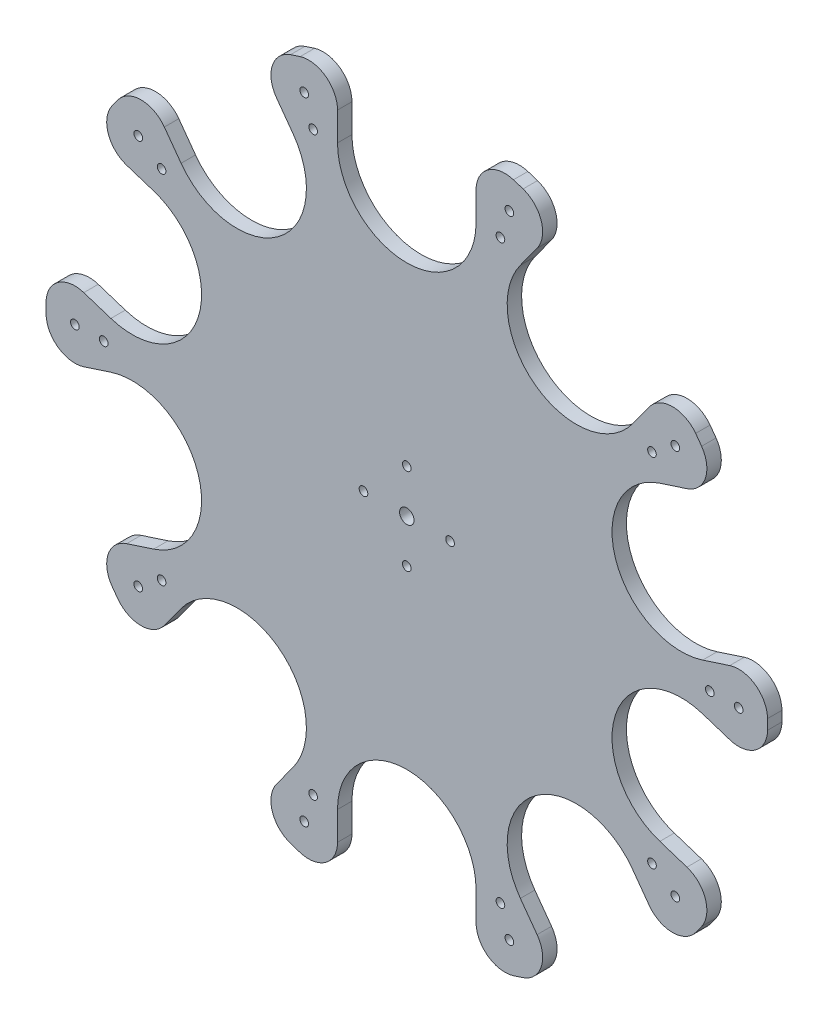
from build123d import *

# Parameters (mm, degrees)
EXTRUDE_1_DEPTH = 5


with BuildPart() as part:
    # 草图1 → 凸台-拉伸1 (new body)
    with BuildSketch(Plane.XY):
        with BuildLine():
            Line((-45.157092485, 102.984644478), (-39.362117364, 95.008545493))
            ThreePointArc((-39.362117364, 95.008545493), (-44.671679174, 61.485291572), (-78.194933094, 66.794853382))
            Line((-78.194933094, 66.794853382), (-83.989908215, 74.770952368))
            ThreePointArc((-83.989908215, 74.770952368), (-87.540173161, 77.803165087), (-92.080078159, 78.893099845))
            ThreePointArc((-92.080078159, 78.893099845), (-96.557407533, 77.83477316), (-100.087041477, 74.88380418))
            ThreePointArc((-100.087041477, 74.88380418), (-101.127124297, 73.473156537), (-102.147326663, 72.048064898))
            ThreePointArc((-102.147326663, 72.048064898), (-103.464208329, 63.127451833), (-97.065710474, 56.773654543))
            Line((-97.065710474, 56.773654543), (-87.689243765, 53.727055829))
            ThreePointArc((-87.689243765, 53.727055829), (-72.280295238, 23.485291572), (-102.522059495, 8.076343046))
            Line((-102.522059495, 8.076343046), (-111.898526204, 11.122941761))
            ThreePointArc((-111.898526204, 11.122941761), (-113.424351497, 11.489260004), (-114.988696148, 11.612376598))
            ThreePointArc((-114.988696148, 11.612376598), (-122.010018437, 8.732842405), (-124.987713204, 1.752583259))
            ThreePointArc((-124.987713204, 1.752583259), (-125, 0), (-124.987713204, -1.752583259))
            ThreePointArc((-124.987713204, -1.752583259), (-120.809688049, -9.743554451), (-111.898526204, -11.122941761))
            Line((-111.898526204, -11.122941761), (-102.522059495, -8.076343046))
            ThreePointArc((-102.522059495, -8.076343046), (-98.86007879, -7.197179263), (-95.10565163, -6.901699437))
            ThreePointArc((-95.10565163, -6.901699437), (-71.401131455, -27.147272277), (-87.689243765, -53.727055829))
            Line((-87.689243765, -53.727055829), (-97.065710474, -56.773654543))
            ThreePointArc((-97.065710474, -56.773654543), (-103.464208329, -63.127451833), (-102.147326663, -72.048064898))
            ThreePointArc((-102.147326663, -72.048064898), (-101.127124297, -73.473156537), (-100.087041477, -74.88380418))
            ThreePointArc((-100.087041477, -74.88380418), (-92.009973106, -78.892854106), (-83.989908215, -74.770952368))
            Line((-83.989908215, -74.770952368), (-78.194933094, -66.794853382))
            ThreePointArc((-78.194933094, -66.794853382), (-69.674297223, -59.517542857), (-58.778525229, -56.901699437))
            ThreePointArc((-58.778525229, -56.901699437), (-37.394368649, -70.005927444), (-39.362117364, -95.008545493))
            Line((-39.362117364, -95.008545493), (-45.157092485, -102.984644478))
            ThreePointArc((-45.157092485, -102.984644478), (-46.598917645, -111.88591714), (-40.290133197, -118.328801088))
            ThreePointArc((-40.290133197, -118.328801088), (-38.627124297, -118.882064537), (-36.956521739, -119.41195711))
            ThreePointArc((-36.956521739, -119.41195711), (-28.065575739, -117.907764962), (-24, -109.859000542))
            Line((-24, -109.859000542), (-24, -100))
            ThreePointArc((-24, -100), (-16.970562748, -83.029437252), (0, -76))
            ThreePointArc((0, -76), (16.970562748, -83.029437252), (24, -100))
            Line((24, -100), (24, -109.859000542))
            ThreePointArc((24, -109.859000542), (28.065575739, -117.907764962), (36.956521739, -119.41195711))
            ThreePointArc((36.956521739, -119.41195711), (38.627124297, -118.882064537), (40.290133197, -118.328801088))
            ThreePointArc((40.290133197, -118.328801088), (46.598917645, -111.88591714), (45.157092485, -102.984644478))
            Line((45.157092485, -102.984644478), (39.362117364, -95.008545493))
            ThreePointArc((39.362117364, -95.008545493), (37.394368649, -70.005927444), (58.778525229, -56.901699437))
            ThreePointArc((58.778525229, -56.901699437), (69.674297223, -59.517542857), (78.194933094, -66.794853382))
            Line((78.194933094, -66.794853382), (83.989908215, -74.770952368))
            ThreePointArc((83.989908215, -74.770952368), (92.009973106, -78.892854106), (100.087041477, -74.88380418))
            ThreePointArc((100.087041477, -74.88380418), (101.127124297, -73.473156537), (102.147326663, -72.048064898))
            ThreePointArc((102.147326663, -72.048064898), (103.464208329, -63.127451833), (97.065710474, -56.773654543))
            Line((97.065710474, -56.773654543), (87.689243765, -53.727055829))
            ThreePointArc((87.689243765, -53.727055829), (71.401131455, -27.147272277), (95.10565163, -6.901699437))
            ThreePointArc((95.10565163, -6.901699437), (98.86007879, -7.197179263), (102.522059495, -8.076343046))
            Line((102.522059495, -8.076343046), (111.898526204, -11.122941761))
            ThreePointArc((111.898526204, -11.122941761), (120.809688049, -9.743554451), (124.987713204, -1.752583259))
            ThreePointArc((124.987713204, -1.752583259), (125, 0), (124.987713204, 1.752583259))
            ThreePointArc((124.987713204, 1.752583259), (122.010018437, 8.732842405), (114.988696148, 11.612376598))
            ThreePointArc((114.988696148, 11.612376598), (113.424351497, 11.489260004), (111.898526204, 11.122941761))
            Line((111.898526204, 11.122941761), (102.522059495, 8.076343046))
            ThreePointArc((102.522059495, 8.076343046), (72.280295238, 23.485291572), (87.689243765, 53.727055829))
            Line((87.689243765, 53.727055829), (97.065710474, 56.773654543))
            ThreePointArc((97.065710474, 56.773654543), (103.464208329, 63.127451833), (102.147326663, 72.048064898))
            ThreePointArc((102.147326663, 72.048064898), (101.127124297, 73.473156537), (100.087041477, 74.88380418))
            ThreePointArc((100.087041477, 74.88380418), (96.557407533, 77.83477316), (92.080078159, 78.893099845))
            ThreePointArc((92.080078159, 78.893099845), (87.540173161, 77.803165087), (83.989908215, 74.770952368))
            Line((83.989908215, 74.770952368), (78.194933094, 66.794853382))
            ThreePointArc((78.194933094, 66.794853382), (44.671679174, 61.485291572), (39.362117364, 95.008545493))
            Line((39.362117364, 95.008545493), (45.157092485, 102.984644478))
            ThreePointArc((45.157092485, 102.984644478), (46.598917645, 111.88591714), (40.290133197, 118.328801088))
            ThreePointArc((40.290133197, 118.328801088), (38.627124297, 118.882064537), (36.956521739, 119.41195711))
            ThreePointArc((36.956521739, 119.41195711), (35.495064265, 119.746608081), (34, 119.859000542))
            ThreePointArc((34, 119.859000542), (26.928932188, 116.930068353), (24, 109.859000542))
            Line((24, 109.859000542), (24, 100))
            ThreePointArc((24, 100), (0, 76), (-24, 100))
            Line((-24, 100), (-24, 109.859000542))
            ThreePointArc((-24, 109.859000542), (-26.928932188, 116.930068353), (-34, 119.859000542))
            ThreePointArc((-34, 119.859000542), (-35.495064265, 119.746608081), (-36.956521739, 119.41195711))
            ThreePointArc((-36.956521739, 119.41195711), (-38.627124297, 118.882064537), (-40.290133197, 118.328801088))
            ThreePointArc((-40.290133197, 118.328801088), (-46.598917645, 111.88591714), (-45.157092485, 102.984644478))
        make_face()
        with BuildLine():
            ThreePointArc((-105, 1.5), (-106.5, 0), (-105, -1.5))
            ThreePointArc((-105, -1.5), (-103.5, 0), (-105, 1.5))
        make_face(mode=Mode.SUBTRACT)
        with BuildLine():
            ThreePointArc((-115, 1.5), (-116.5, 0), (-115, -1.5))
            ThreePointArc((-115, -1.5), (-113.5, 0), (-115, 1.5))
        make_face(mode=Mode.SUBTRACT)
        with BuildLine():
            ThreePointArc((0, 2.5), (-2.5, 0), (0, -2.5))
            ThreePointArc((0, -2.5), (2.5, 0), (0, 2.5))
        make_face(mode=Mode.SUBTRACT)
        with BuildLine():
            ThreePointArc((-84.065106531, 62.930976982), (-86.160309901, 62.599129369), (-85.828462288, 60.503925999))
            ThreePointArc((-85.828462288, 60.503925999), (-83.733258918, 60.835773612), (-84.065106531, 62.930976982))
        make_face(mode=Mode.SUBTRACT)
        with BuildLine():
            ThreePointArc((-92.155276475, 68.808829505), (-94.250479845, 68.476981892), (-93.918632232, 66.381778522))
            ThreePointArc((-93.918632232, 66.381778522), (-91.823428862, 66.713626135), (-92.155276475, 68.808829505))
        make_face(mode=Mode.SUBTRACT)
        with BuildLine():
            ThreePointArc((-31.020199635, 100.324459703), (-32.910309901, 101.287518985), (-33.873369184, 99.397408719))
            ThreePointArc((-33.873369184, 99.397408719), (-31.983258918, 98.434349437), (-31.020199635, 100.324459703))
        make_face(mode=Mode.SUBTRACT)
        with BuildLine():
            ThreePointArc((-34.110369579, 109.835024866), (-36.000479845, 110.798084148), (-36.963539128, 108.907973882))
            ThreePointArc((-36.963539128, 108.907973882), (-35.073428862, 107.9449146), (-34.110369579, 109.835024866))
        make_face(mode=Mode.SUBTRACT)
        with BuildLine():
            ThreePointArc((33.873369184, 99.397408719), (32.910309901, 101.287518985), (31.020199635, 100.324459703))
            ThreePointArc((31.020199635, 100.324459703), (31.983258918, 98.434349437), (33.873369184, 99.397408719))
        make_face(mode=Mode.SUBTRACT)
        with BuildLine():
            ThreePointArc((36.963539128, 108.907973882), (36.000479845, 110.798084148), (34.110369579, 109.835024866))
            ThreePointArc((34.110369579, 109.835024866), (35.073428862, 107.944914599), (36.963539128, 108.907973882))
        make_face(mode=Mode.SUBTRACT)
        with BuildLine():
            ThreePointArc((85.828462288, 60.503925999), (86.160309901, 62.599129369), (84.065106531, 62.930976982))
            ThreePointArc((84.065106531, 62.930976982), (83.733258918, 60.835773612), (85.828462288, 60.503925999))
        make_face(mode=Mode.SUBTRACT)
        with BuildLine():
            ThreePointArc((93.918632232, 66.381778522), (94.250479845, 68.476981892), (92.155276475, 68.808829505))
            ThreePointArc((92.155276475, 68.808829505), (91.823428862, 66.713626135), (93.918632232, 66.381778522))
        make_face(mode=Mode.SUBTRACT)
        with BuildLine():
            ThreePointArc((105, -1.5), (106.5, 0), (105, 1.5))
            ThreePointArc((105, 1.5), (103.5, 0), (105, -1.5))
        make_face(mode=Mode.SUBTRACT)
        with BuildLine():
            ThreePointArc((115, -1.5), (116.5, 0), (115, 1.5))
            ThreePointArc((115, 1.5), (113.5, 0), (115, -1.5))
        make_face(mode=Mode.SUBTRACT)
        with BuildLine():
            ThreePointArc((84.065106531, -62.930976982), (86.160309901, -62.599129369), (85.828462288, -60.503925999))
            ThreePointArc((85.828462288, -60.503925999), (83.733258918, -60.835773612), (84.065106531, -62.930976982))
        make_face(mode=Mode.SUBTRACT)
        with BuildLine():
            ThreePointArc((92.155276475, -68.808829505), (94.250479845, -68.476981892), (93.918632232, -66.381778522))
            ThreePointArc((93.918632232, -66.381778522), (91.823428862, -66.713626135), (92.155276475, -68.808829505))
        make_face(mode=Mode.SUBTRACT)
        with BuildLine():
            ThreePointArc((31.020199635, -100.324459703), (32.910309901, -101.287518985), (33.873369184, -99.397408719))
            ThreePointArc((33.873369184, -99.397408719), (31.983258918, -98.434349437), (31.020199635, -100.324459703))
        make_face(mode=Mode.SUBTRACT)
        with BuildLine():
            ThreePointArc((34.110369579, -109.835024866), (36.000479845, -110.798084148), (36.963539128, -108.907973882))
            ThreePointArc((36.963539128, -108.907973882), (35.073428862, -107.9449146), (34.110369579, -109.835024866))
        make_face(mode=Mode.SUBTRACT)
        with BuildLine():
            ThreePointArc((-33.873369184, -99.397408719), (-32.910309901, -101.287518985), (-31.020199635, -100.324459703))
            ThreePointArc((-31.020199635, -100.324459703), (-31.983258918, -98.434349437), (-33.873369184, -99.397408719))
        make_face(mode=Mode.SUBTRACT)
        with BuildLine():
            ThreePointArc((-36.963539128, -108.907973882), (-36.000479845, -110.798084148), (-34.110369579, -109.835024866))
            ThreePointArc((-34.110369579, -109.835024866), (-35.073428862, -107.944914599), (-36.963539128, -108.907973882))
        make_face(mode=Mode.SUBTRACT)
        with BuildLine():
            ThreePointArc((-85.828462288, -60.503925999), (-86.160309901, -62.599129369), (-84.065106531, -62.930976982))
            ThreePointArc((-84.065106531, -62.930976982), (-83.733258918, -60.835773612), (-85.828462288, -60.503925999))
        make_face(mode=Mode.SUBTRACT)
        with BuildLine():
            ThreePointArc((-93.918632232, -66.381778522), (-94.250479845, -68.476981892), (-92.155276475, -68.808829505))
            ThreePointArc((-92.155276475, -68.808829505), (-91.823428862, -66.713626135), (-93.918632232, -66.381778522))
        make_face(mode=Mode.SUBTRACT)
        with BuildLine():
            ThreePointArc((15, 1.5), (13.5, 0), (15, -1.5))
            ThreePointArc((15, -1.5), (16.5, 0), (15, 1.5))
        make_face(mode=Mode.SUBTRACT)
        with BuildLine():
            ThreePointArc((0, -16.5), (1.5, -15), (0, -13.5))
            ThreePointArc((0, -13.5), (-1.5, -15), (0, -16.5))
        make_face(mode=Mode.SUBTRACT)
        with BuildLine():
            ThreePointArc((-15, 1.5), (-16.5, 0), (-15, -1.5))
            ThreePointArc((-15, -1.5), (-13.5, 0), (-15, 1.5))
        make_face(mode=Mode.SUBTRACT)
        with BuildLine():
            ThreePointArc((0, 16.5), (-1.5, 15), (0, 13.5))
            ThreePointArc((0, 13.5), (1.5, 15), (0, 16.5))
        make_face(mode=Mode.SUBTRACT)
    extrude(amount=EXTRUDE_1_DEPTH)


solid = part.part
